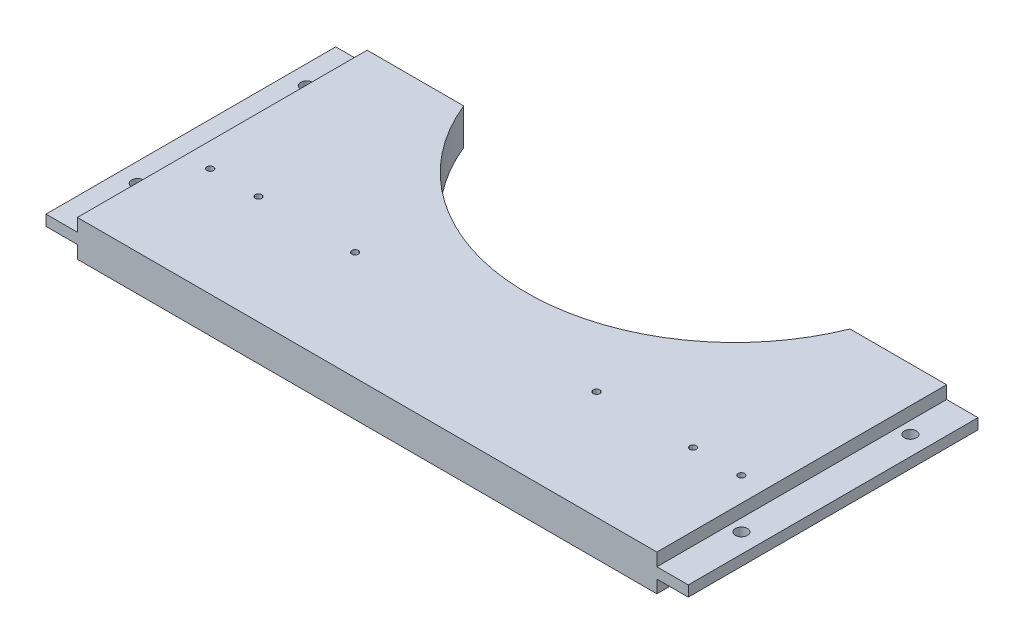
from build123d import *

# Parameters (mm, degrees)
BOSS_EXTRUDE1_DEPTH         = 9.525
F_8_32_TAPPED_HOLE1_D       = 3.4544
SKETCH6_W                   = 16.51
SKETCH6_H                   = 152.4
BOSS_EXTRUDE2_DEPTH         = 2.794
F_1_4_0_25_DIAMETER_HOLE1_D = 6.35


with BuildPart() as part:
    # Sketch1 → Boss-Extrude1 (new, symmetric)
    with BuildSketch(Plane(origin=(0, 0, 0), x_dir=(1, 0, 0), z_dir=(0, 1, 0))):
        with BuildLine():
            ThreePointArc((0, 7.62), (-61.289836841, 26.369500976), (-101.6, 76.2))
            Line((-101.6, 76.2), (-152.4, 76.2))
            Line((-152.4, 76.2), (-152.4, -76.2))
            Line((-152.4, -76.2), (152.4, -76.2))
            Line((152.4, -76.2), (152.4, 76.2))
            Line((152.4, 76.2), (101.6, 76.2))
            ThreePointArc((101.6, 76.2), (61.289836841, 26.369500976), (0, 7.62))
        make_face()
    extrude(amount=BOSS_EXTRUDE1_DEPTH, both=True)

    # #8-32 Tapped Hole1 (through all)
    with Locations(Plane(origin=(0, 9.525, 0), x_dir=(1, 0, 0), z_dir=(0, 1, 0))):
        with Locations((-139.7, -19.05), (-114.3, -19.05), (-63.5, -19.05)):
            f_8_32_tapped_hole1 = Hole(F_8_32_TAPPED_HOLE1_D / 2)

    # Mirror1: #8-32 Tapped Hole1 across plane
    add(f_8_32_tapped_hole1.mirror(Plane(origin=(0, 0, 0), x_dir=(0, 0, 1), z_dir=(1, 0, 0))), mode=Mode.SUBTRACT)

    # Sketch6 → Boss-Extrude2 (add, symmetric)
    with BuildSketch(Plane(origin=(0, 0, 0), x_dir=(1, 0, 0), z_dir=(0, 1, 0))):
        with Locations((-160.655, 0)):
            Rectangle(SKETCH6_W, SKETCH6_H)
    boss_extrude2 = extrude(amount=BOSS_EXTRUDE2_DEPTH, both=True)

    # 1/4 (0.25) Diameter Hole1 (through all)
    with Locations(Plane(origin=(0, 2.794, 0), x_dir=(1, 0, 0), z_dir=(0, 1, 0))):
        with Locations((-158.75, 50.8), (-158.75, -38.1)):
            f_1_4_0_25_diameter_hole1 = Hole(F_1_4_0_25_DIAMETER_HOLE1_D / 2)

    # Mirror2: Boss-Extrude2, 1/4 (0.25) Diameter Hole1 across plane
    add(boss_extrude2.mirror(Plane(origin=(0, 0, 0), x_dir=(0, 0, 1), z_dir=(1, 0, 0))))
    add(f_1_4_0_25_diameter_hole1.mirror(Plane(origin=(0, 0, 0), x_dir=(0, 0, 1), z_dir=(1, 0, 0))), mode=Mode.SUBTRACT)


solid = part.part
